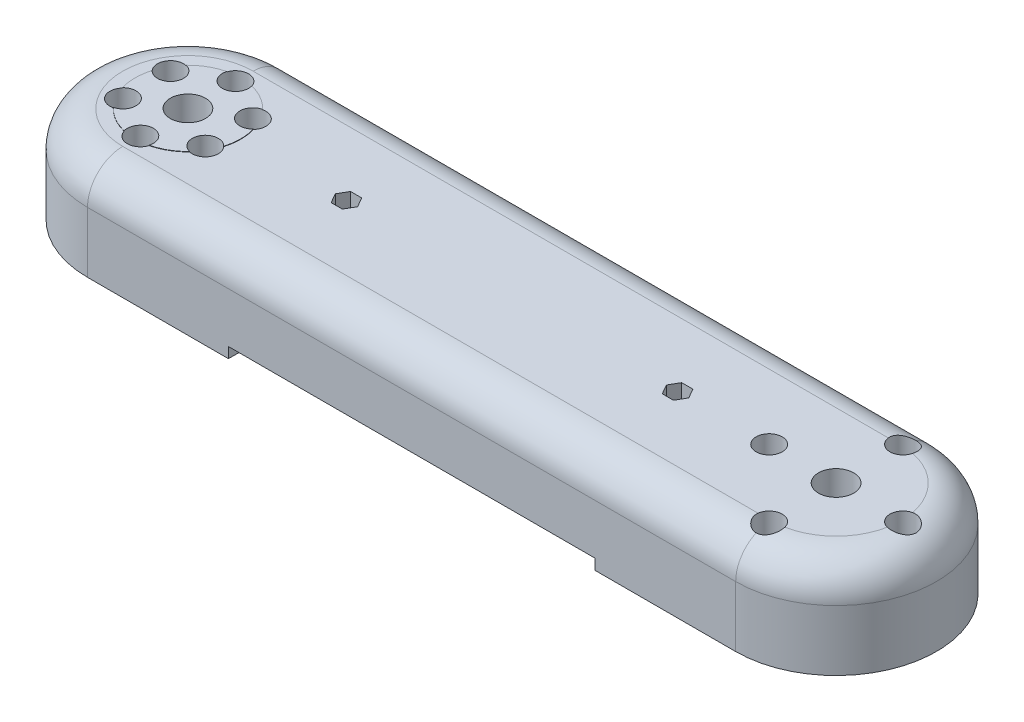
from build123d import *

# Parameters (mm, degrees)
EXTRUDE_1_DEPTH          = 27.2
SKETCH_2_R               = 15
EXTRUDE_2_DEPTH          = 0.1
SKETCH_3_R               = 1.7
CUT_EXTRUDE_2_DEPTH      = 41
SKETCH_4_R               = 5
CUT_EXTRUDE_3_DEPTH      = 41
SKETCH_6_R               = 5
SKETCH_6_R_2             = 1.7
CUT_EXTRUDE_4_DEPTH      = 60
SKETCH_8_R               = 3.7
CUT_EXTRUDE_5_DEPTH      = 11.2
CUT_EXTRUDE_6_DEPTH      = 40
CUT_EXTRUDE_7_DEPTH      = 14.5
CUT_EXTRUDE_7_DEPTH_BACK = 12.7
SKETCH_24_R              = 3.7
FILLET_1_R               = 10
SKETCH_25_W              = 104
SKETCH_25_H              = 148.506502633
CUT_EXTRUDE_8_DEPTH      = 3
SKETCH_26_W              = 84
SKETCH_26_H              = 40
CUT_EXTRUDE_9_DEPTH      = 5
SKETCH_27_R              = 1.7
CUT_EXTRUDE_10_DEPTH     = 55
CUT_EXTRUDE_11_DEPTH     = 7.2


with BuildPart() as part:
    # 草图1 → 凸台-拉伸1 (new body)
    with BuildSketch(Plane(origin=(0, 0, 0), x_dir=(1, 0, 0), z_dir=(0, 1, 0))):
        with BuildLine():
            Line((0, 28.5), (220, 28.5))
            Line((220, 28.5), (220, -28.5))
            Line((220, -28.5), (0, -28.5))
            ThreePointArc((0, -28.5), (-28.5, 0), (0, 28.5))
        make_face()
    extrude(amount=EXTRUDE_1_DEPTH)

    # 草图2 → 凸台-拉伸2 (add)
    with BuildSketch(Plane(origin=(0, 27.2, 0), x_dir=(1, 0, 0), z_dir=(0, 1, 0))):
        with Locations(Location((0, 0, 0), (0, 0, 270))):
            Circle(SKETCH_2_R)
    extrude(amount=EXTRUDE_2_DEPTH)

    # 草图3 → 切除-拉伸2 (cut)
    with BuildSketch(Plane(origin=(0, 27.3, 0), x_dir=(1, 0, 0), z_dir=(0, 1, 0))):
        with Locations(Location((0, 13.5, 0), (0, 0, 270))):
            Circle(SKETCH_3_R)
        with Locations(Location((11.691342951, 6.75, 0), (0, 0, 270))):
            Circle(SKETCH_3_R)
        with Locations(Location((11.691342951, -6.75, 0), (0, 0, 270))):
            Circle(SKETCH_3_R)
        with Locations(Location((0, -13.5, 0), (0, 0, 270))):
            Circle(SKETCH_3_R)
        with Locations(Location((-11.691342951, -6.75, 0), (0, 0, 270))):
            Circle(SKETCH_3_R)
        with Locations(Location((-11.691342951, 6.75, 0), (0, 0, 270))):
            Circle(SKETCH_3_R)
    extrude(amount=-CUT_EXTRUDE_2_DEPTH, mode=Mode.SUBTRACT)

    # 草图4 → 切除-拉伸3 (cut)
    with BuildSketch(Plane(origin=(0, 27.3, 0), x_dir=(1, 0, 0), z_dir=(0, 1, 0))):
        with Locations(Location((0, 0, 0), (0, 0, 270))):
            Circle(SKETCH_4_R)
    extrude(amount=-CUT_EXTRUDE_3_DEPTH, mode=Mode.SUBTRACT)

    # 草图6 → 切除-拉伸4 (cut)
    with BuildSketch(Plane(origin=(0, 27.2, 0), x_dir=(1, 0, 0), z_dir=(0, 1, 0))):
        with Locations(Location((184, 0, 0), (0, 0, 270))):
            Circle(SKETCH_6_R)
        with Locations(Location((184, 19, 0), (0, 0, 270))):
            Circle(SKETCH_6_R_2)
        with Locations(Location((165, 0, 0), (0, 0, 270))):
            Circle(SKETCH_6_R_2)
        with Locations(Location((184, -19, 0), (0, 0, 270))):
            Circle(SKETCH_6_R_2)
        with Locations(Location((203, 0, 0), (0, 0, 270))):
            Circle(SKETCH_6_R_2)
    extrude(amount=-CUT_EXTRUDE_4_DEPTH, mode=Mode.SUBTRACT)

    # 草图8 → 切除-拉伸5 (cut)
    with BuildSketch(Plane(origin=(0, 27.2, 0), x_dir=(1, 0, 0), z_dir=(0, 1, 0))):
        with Locations(Location((184, 19, 0), (0, 0, 270))):
            Circle(SKETCH_8_R)
        with Locations(Location((203, 0, 0), (0, 0, 270))):
            Circle(SKETCH_8_R)
        with Locations(Location((184, -19, 0), (0, 0, 270))):
            Circle(SKETCH_8_R)
        with Locations(Location((165, 0, 0), (0, 0, 270))):
            Circle(SKETCH_8_R)
    extrude(amount=-CUT_EXTRUDE_5_DEPTH, mode=Mode.SUBTRACT)

    # 草图20 → 切除-拉伸6 (cut)
    with BuildSketch(Plane(origin=(0, 27.2, 0), x_dir=(1, 0, 0), z_dir=(0, 1, 0))):
        with BuildLine():
            Line((184, 28.5), (231.029995119, 28.5))
            Line((231.029995119, 28.5), (231.029995119, -33.501225727))
            Line((231.029995119, -33.501225727), (184, -33.501225727))
            Line((184, -33.501225727), (184, -28.5))
            ThreePointArc((184, -28.5), (212.5, 0), (184, 28.5))
        make_face()
    extrude(amount=-CUT_EXTRUDE_6_DEPTH, mode=Mode.SUBTRACT)

    # 草图24 → 切除-拉伸7 (cut, two sides: drawn at the far end of the back side and taken through both)
    with BuildSketch(Plane(origin=(0, 27.2, 0), x_dir=(1, 0, 0), z_dir=(0, 1, 0)).offset(-CUT_EXTRUDE_7_DEPTH_BACK)):
        with Locations(Location((0, -13.5, 0), (0, 0, 343.088700116))):
            Circle(SKETCH_24_R)
        with Locations(Location((-11.691342951, -6.75, 0), (0, 0, 136.911299884))):
            Circle(SKETCH_24_R)
        with Locations(Location((-11.691342951, 6.75, 0), (0, 0, 76.911299884))):
            Circle(SKETCH_24_R)
        with Locations(Location((0, 13.5, 0), (0, 0, 16.911299884))):
            Circle(SKETCH_24_R)
        with Locations(Location((11.691342951, 6.75, 0), (0, 0, 103.088700116))):
            Circle(SKETCH_24_R)
        with Locations(Location((11.691342951, -6.75, 0), (0, 0, 43.088700116))):
            Circle(SKETCH_24_R)
    extrude(amount=CUT_EXTRUDE_7_DEPTH + CUT_EXTRUDE_7_DEPTH_BACK, mode=Mode.SUBTRACT)

    # 圆角1
    # the kernel refuses this fillet: 10 mm, written as the material it takes off along each edge
    with BuildSketch(Plane(origin=(0, 27.2, -28.5), x_dir=(0, -1, 0), z_dir=(1, 0, 0))) as fillet_1_piece_1:
        with BuildLine():
            CenterArc((FILLET_1_R, -FILLET_1_R), FILLET_1_R, 90, 90)
            Line((0, -FILLET_1_R), (0, 0))
            Line((0, 0), (FILLET_1_R, 0))
        make_face()
    extrude(amount=184, mode=Mode.SUBTRACT)
    with BuildSketch(Plane(origin=(184, 27.2, 0), x_dir=(0, 0, 1), z_dir=(-1, 0, 0))) as fillet_1_piece_2:
        with BuildLine():
            CenterArc((28.5 - FILLET_1_R, -FILLET_1_R), FILLET_1_R, 0, 90)
            Line((28.5 - FILLET_1_R, 0), (28.5, 0))
            Line((28.5, 0), (28.5, -FILLET_1_R))
        make_face()
    revolve(axis=Axis((184, 27.2, 0), (0, 1, 0)), revolution_arc=180, mode=Mode.SUBTRACT)
    with BuildSketch(Plane(origin=(0, 27.2, 0), x_dir=(0, 0, 1), z_dir=(1, 0, 0))) as fillet_1_piece_3:
        with BuildLine():
            CenterArc((28.5 - FILLET_1_R, FILLET_1_R), FILLET_1_R, 270, 90)
            Line((28.5, FILLET_1_R), (28.5, 0))
            Line((28.5, 0), (28.5 - FILLET_1_R, 0))
        make_face()
    revolve(axis=Axis((0, 27.2, 0), (0, -1, 0)), revolution_arc=180, mode=Mode.SUBTRACT)
    with BuildSketch(Plane(origin=(184, 27.2, 28.5), x_dir=(0, 0, -1), z_dir=(-1, 0, 0))) as fillet_1_piece_4:
        with BuildLine():
            CenterArc((FILLET_1_R, FILLET_1_R), FILLET_1_R, 180, 90)
            Line((0, FILLET_1_R), (0, 0))
            Line((0, 0), (FILLET_1_R, 0))
        make_face()
    extrude(amount=184, mode=Mode.SUBTRACT)

    # 草图25 → 切除-拉伸8 (cut)
    with BuildSketch(Plane.XZ):
        with Locations((92, -1.302688619)):
            Rectangle(SKETCH_25_W, SKETCH_25_H)
    extrude(amount=-CUT_EXTRUDE_8_DEPTH, mode=Mode.SUBTRACT)

    # 草图26 → 切除-拉伸9 (cut)
    with BuildSketch(Plane.XZ.offset(-3)):
        with Locations((92, 0)):
            Rectangle(SKETCH_26_W, SKETCH_26_H)
    extrude(amount=-CUT_EXTRUDE_9_DEPTH, mode=Mode.SUBTRACT)

    # 草图27 → 切除-拉伸10 (cut)
    with BuildSketch(Plane.XZ.offset(-3)):
        with Locations(Location((45, 0, 0), (0, 0, 270))):
            Circle(SKETCH_27_R)
        with Locations(Location((139, 0, 0), (0, 0, 270))):
            Circle(SKETCH_27_R)
    extrude(amount=-CUT_EXTRUDE_10_DEPTH, mode=Mode.SUBTRACT)

    # 草图28 → 切除-拉伸11 (cut)
    with BuildSketch(Plane(origin=(0, 27.2, 0), x_dir=(1, 0, 0), z_dir=(0, 1, 0))):
        Polygon((41.824573519, 0), (43.41228676, -2.75), (46.58771324, -2.75), (48.175426481, 0), (46.58771324, 2.75), (43.41228676, 2.75), align=None)
        Polygon((135.824573519, 0), (137.41228676, -2.75), (140.58771324, -2.75), (142.175426481, 0), (140.58771324, 2.75), (137.41228676, 2.75), align=None)
    extrude(amount=-CUT_EXTRUDE_11_DEPTH, mode=Mode.SUBTRACT)


solid = part.part
